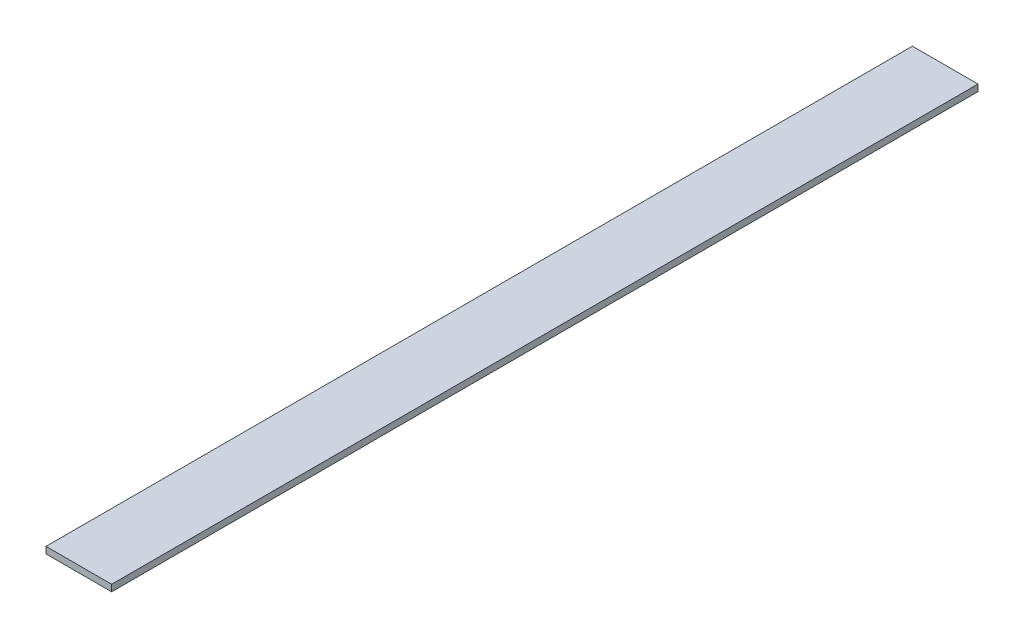
from build123d import *

# Parameters (mm, degrees)
SKETCH1_W           = 30
SKETCH1_H           = 396
BOSS_EXTRUDE1_DEPTH = 3


with BuildPart() as part:
    # Sketch1 → Boss-Extrude1 (new body)
    with BuildSketch(Plane(origin=(0, 0, 0), x_dir=(1, 0, 0), z_dir=(0, 1, 0))):
        with Locations((-21.516129032, 110.756272401)):
            Rectangle(SKETCH1_W, SKETCH1_H)
    extrude(amount=BOSS_EXTRUDE1_DEPTH)


solid = part.part
